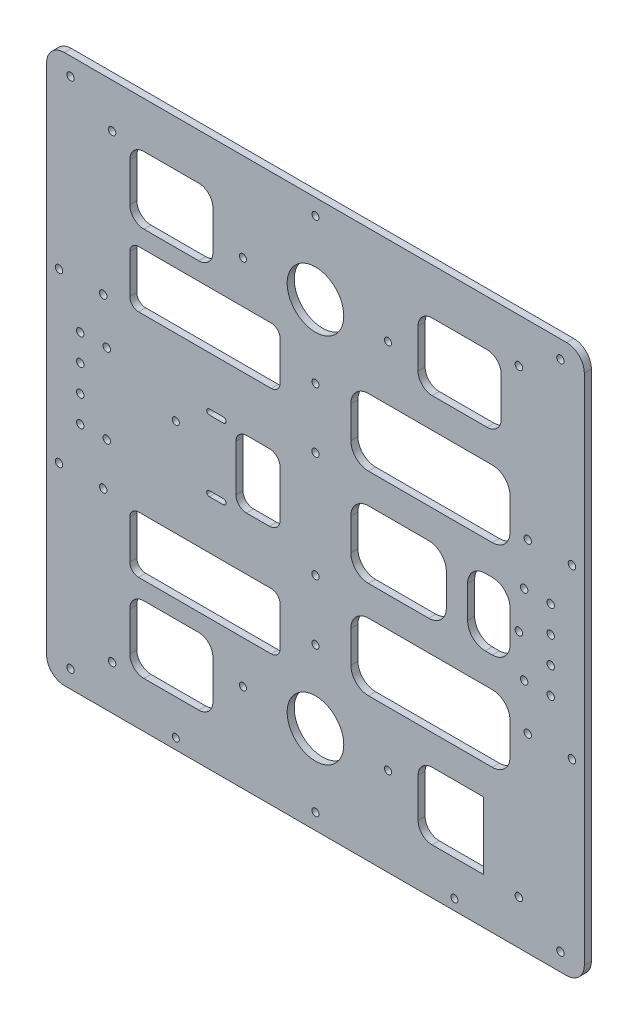
from build123d import *

# Parameters (mm, degrees)
SKETCH_1_R          = 2.1
SKETCH_1_R_2        = 2
SKETCH_1_R_3        = 16
EXTRUDE_1_DEPTH     = 4
CUT_EXTRUDE_1_REACH = 219.129
SKETCH_2_R          = 2.1
CUT_EXTRUDE_2_REACH = 219.129
SKETCH_3_R          = 2.1
CUT_EXTRUDE_3_REACH = 219.129
SKETCH_4_R          = 2.1
SKETCH_5_W          = 9.074439696
SKETCH_5_H          = 39.429402793
SKETCH_5_W_2        = 9.116595703
SKETCH_5_H_2        = 38.060432974
EXTRUDE_2_DEPTH     = 4
FILLET_1_R          = 8
SKETCH_6_W          = 8.766607102
SKETCH_6_H          = 39.413082466
SKETCH_6_W_2        = 8
EXTRUDE_3_DEPTH     = 4
FILLET_2_R          = 8
SKETCH_8_W          = 16.411626396
SKETCH_8_H          = 15.682220778
SKETCH_8_W_2        = 10.941084264
SKETCH_8_H_2        = 10.211678646
SKETCH_8_W_3        = 13.07641526
SKETCH_8_H_3        = 17.165917396
SKETCH_8_W_4        = 15.501833168
SKETCH_8_H_4        = 13.086487615
EXTRUDE_4_DEPTH     = 4
CUT_EXTRUDE_4_REACH = 219.129
SKETCH_7_R          = 2
SKETCH_9_R          = 2
CUT_EXTRUDE_5_DEPTH = 10
SKETCH_10_W         = 12
SKETCH_10_H         = 38
EXTRUDE_5_DEPTH     = 4
FILLET_3_R          = 10
SKETCH_12_W         = 10.901521511
SKETCH_12_H         = 38
EXTRUDE_6_DEPTH     = 4


with BuildPart() as part:
    # 草图1 → 凸台-拉伸1 (new body)
    with BuildSketch(Plane(origin=(0, 0, 0), x_dir=(-1, 0, 0), z_dir=(0, 0, -1))):
        with BuildLine():
            Line((142, 155), (-142, 155))
            ThreePointArc((-142, 155), (-149.071067812, 152.071067812), (-152, 145))
            Line((-152, 145), (-152, -145))
            ThreePointArc((-152, -145), (-149.071067812, -152.071067812), (-142, -155))
            Line((-142, -155), (142, -155))
            ThreePointArc((142, -155), (149.071067812, -152.071067812), (152, -145))
            Line((152, -145), (152, 145))
            ThreePointArc((152, 145), (149.071067812, 152.071067812), (142, 155))
        make_face()
        with Locations((0, 63.987806691)):
            Circle(SKETCH_1_R, mode=Mode.SUBTRACT)
        with Locations((0, 146.012193309)):
            Circle(SKETCH_1_R, mode=Mode.SUBTRACT)
        with Locations((0, -146.012193309)):
            Circle(SKETCH_1_R, mode=Mode.SUBTRACT)
        with Locations((41, 105)):
            Circle(SKETCH_1_R_2, mode=Mode.SUBTRACT)
        with Locations((0, -105)):
            Circle(SKETCH_1_R_3, mode=Mode.SUBTRACT)
        with Locations((0, 105)):
            Circle(SKETCH_1_R_3, mode=Mode.SUBTRACT)
        with Locations((0, -63.987806691)):
            Circle(SKETCH_1_R, mode=Mode.SUBTRACT)
        with Locations((-41, -105)):
            Circle(SKETCH_1_R_2, mode=Mode.SUBTRACT)
        with Locations((41, -105)):
            Circle(SKETCH_1_R_2, mode=Mode.SUBTRACT)
        with Locations((-41, 105)):
            Circle(SKETCH_1_R_2, mode=Mode.SUBTRACT)
        with Locations((120, 47.5)):
            Circle(SKETCH_1_R, mode=Mode.SUBTRACT)
        with Locations((-145, 47.5)):
            Circle(SKETCH_1_R, mode=Mode.SUBTRACT)
        with Locations((-145, -47.5)):
            Circle(SKETCH_1_R, mode=Mode.SUBTRACT)
        with Locations((-120, -47.5)):
            Circle(SKETCH_1_R, mode=Mode.SUBTRACT)
        with Locations((120, -47.5)):
            Circle(SKETCH_1_R, mode=Mode.SUBTRACT)
        with Locations((145, -47.5)):
            Circle(SKETCH_1_R, mode=Mode.SUBTRACT)
        with Locations((-115, 0)):
            Circle(SKETCH_1_R, mode=Mode.SUBTRACT)
        with Locations((145, 47.5)):
            Circle(SKETCH_1_R, mode=Mode.SUBTRACT)
        with Locations((0, -30)):
            Circle(SKETCH_1_R, mode=Mode.SUBTRACT)
        with Locations((0, 30)):
            Circle(SKETCH_1_R, mode=Mode.SUBTRACT)
        with Locations((115, 130)):
            Circle(SKETCH_1_R, mode=Mode.SUBTRACT)
        with Locations((115, -130)):
            Circle(SKETCH_1_R, mode=Mode.SUBTRACT)
        with Locations((-115, -130)):
            Circle(SKETCH_1_R, mode=Mode.SUBTRACT)
        with Locations((-115, 130)):
            Circle(SKETCH_1_R, mode=Mode.SUBTRACT)
        with Locations((-120, 47.5)):
            Circle(SKETCH_1_R, mode=Mode.SUBTRACT)
        with BuildLine():
            Line((60, -21.5), (52, -21.5))
            ThreePointArc((52, -21.5), (50.5, -20), (52, -18.5))
            Line((52, -18.5), (60, -18.5))
            ThreePointArc((60, -18.5), (61.5, -20), (60, -21.5))
        make_face(mode=Mode.SUBTRACT)
        with BuildLine():
            Line((60, 18.5), (52, 18.5))
            ThreePointArc((52, 18.5), (50.5, 20), (52, 21.5))
            Line((52, 21.5), (60, 21.5))
            ThreePointArc((60, 21.5), (61.5, 20), (60, 18.5))
        make_face(mode=Mode.SUBTRACT)
        with BuildLine():
            Line((-100, -36), (-30, -36))
            ThreePointArc((-30, -36), (-22.928932188, -38.928932188), (-20, -46))
            Line((-20, -46), (-20, -64))
            ThreePointArc((-20, -64), (-22.928932188, -71.071067812), (-30, -74))
            Line((-30, -74), (-100, -74))
            ThreePointArc((-100, -74), (-107.071067812, -71.071067812), (-110, -64))
            Line((-110, -64), (-110, -46))
            ThreePointArc((-110, -46), (-107.071067812, -38.928932188), (-100, -36))
        make_face(mode=Mode.SUBTRACT)
        with BuildLine():
            Line((-100, 19), (-30, 19))
            ThreePointArc((-30, 19), (-22.928932188, 16.071067812), (-20, 9))
            Line((-20, 9), (-20, -9))
            ThreePointArc((-20, -9), (-22.928932188, -16.071067812), (-30, -19))
            Line((-30, -19), (-100, -19))
            ThreePointArc((-100, -19), (-107.071067812, -16.071067812), (-110, -9))
            Line((-110, -9), (-110, 9))
            ThreePointArc((-110, 9), (-107.071067812, 16.071067812), (-100, 19))
        make_face(mode=Mode.SUBTRACT)
        with BuildLine():
            Line((-100, 74), (-30, 74))
            ThreePointArc((-30, 74), (-22.928932188, 71.071067812), (-20, 64))
            Line((-20, 64), (-20, 46))
            ThreePointArc((-20, 46), (-22.928932188, 38.928932188), (-30, 36))
            Line((-30, 36), (-100, 36))
            ThreePointArc((-100, 36), (-107.071067812, 38.928932188), (-110, 46))
            Line((-110, 46), (-110, 64))
            ThreePointArc((-110, 64), (-107.071067812, 71.071067812), (-100, 74))
        make_face(mode=Mode.SUBTRACT)
        with BuildLine():
            Line((25, 81), (100, 81))
            ThreePointArc((100, 81), (103.535533906, 79.535533906), (105, 76))
            Line((105, 76), (105, 54))
            ThreePointArc((105, 54), (103.535533906, 50.464466094), (100, 49))
            Line((100, 49), (25, 49))
            ThreePointArc((25, 49), (21.464466094, 50.464466094), (20, 54))
            Line((20, 54), (20, 76))
            ThreePointArc((20, 76), (21.464466094, 79.535533906), (25, 81))
        make_face(mode=Mode.SUBTRACT)
        with BuildLine():
            Line((25, -49), (100, -49))
            ThreePointArc((100, -49), (103.535533906, -50.464466094), (105, -54))
            Line((105, -54), (105, -76))
            ThreePointArc((105, -76), (103.535533906, -79.535533906), (100, -81))
            Line((100, -81), (25, -81))
            ThreePointArc((25, -81), (21.464466094, -79.535533906), (20, -76))
            Line((20, -76), (20, -54))
            ThreePointArc((20, -54), (21.464466094, -50.464466094), (25, -49))
        make_face(mode=Mode.SUBTRACT)
        with BuildLine():
            Line((-97, 129), (-58, 129))
            ThreePointArc((-58, 129), (-52.343145751, 126.656854249), (-50, 121))
            Line((-50, 121), (-50, 99))
            ThreePointArc((-50, 99), (-52.343145751, 93.343145751), (-58, 91))
            Line((-58, 91), (-97, 91))
            ThreePointArc((-97, 91), (-102.656854249, 93.343145751), (-105, 99))
            Line((-105, 99), (-105, 121))
            ThreePointArc((-105, 121), (-102.656854249, 126.656854249), (-97, 129))
        make_face(mode=Mode.SUBTRACT)
        with BuildLine():
            Line((97, 91), (58, 91))
            ThreePointArc((58, 91), (52.343145751, 93.343145751), (50, 99))
            Line((50, 99), (50, 121))
            ThreePointArc((50, 121), (52.343145751, 126.656854249), (58, 129))
            Line((58, 129), (97, 129))
            ThreePointArc((97, 129), (102.656854249, 126.656854249), (105, 121))
            Line((105, 121), (105, 99))
            ThreePointArc((105, 99), (102.656854249, 93.343145751), (97, 91))
        make_face(mode=Mode.SUBTRACT)
        with BuildLine():
            Line((39, -19), (26, -19))
            ThreePointArc((26, -19), (21.757359313, -17.242640687), (20, -13))
            Line((20, -13), (20, 13))
            ThreePointArc((20, 13), (21.757359313, 17.242640687), (26, 19))
            Line((26, 19), (39, 19))
            ThreePointArc((39, 19), (43.242640687, 17.242640687), (45, 13))
            Line((45, 13), (45, -13))
            ThreePointArc((45, -13), (43.242640687, -17.242640687), (39, -19))
        make_face(mode=Mode.SUBTRACT)
        with BuildLine():
            Line((97, -129), (58, -129))
            ThreePointArc((58, -129), (52.343145751, -126.656854249), (50, -121))
            Line((50, -121), (50, -99))
            ThreePointArc((50, -99), (52.343145751, -93.343145751), (58, -91))
            Line((58, -91), (97, -91))
            ThreePointArc((97, -91), (102.656854249, -93.343145751), (105, -99))
            Line((105, -99), (105, -121))
            ThreePointArc((105, -121), (102.656854249, -126.656854249), (97, -129))
        make_face(mode=Mode.SUBTRACT)
        with BuildLine():
            Line((-97, -91), (-58, -91))
            ThreePointArc((-58, -91), (-52.343145751, -93.343145751), (-50, -99))
            Line((-50, -99), (-50, -121))
            ThreePointArc((-50, -121), (-52.343145751, -126.656854249), (-58, -129))
            Line((-58, -129), (-97, -129))
            ThreePointArc((-97, -129), (-102.656854249, -126.656854249), (-105, -121))
            Line((-105, -121), (-105, -99))
            ThreePointArc((-105, -99), (-102.656854249, -93.343145751), (-97, -91))
        make_face(mode=Mode.SUBTRACT)
    extrude(amount=-EXTRUDE_1_DEPTH)

    # 草图2 → 切除-拉伸1 (cut, up to next)
    with BuildSketch(Plane(origin=(0, 0, 0), x_dir=(-1, 0, 0), z_dir=(0, 0, -1)), mode=Mode.PRIVATE) as cut_extrude_1_sk1:
        with Locations((-138.5, 145)):
            Circle(SKETCH_2_R)
    cut_extrude_1_tool1 = extrude(cut_extrude_1_sk1.sketch, amount=-CUT_EXTRUDE_1_REACH, mode=Mode.PRIVATE) & part.part
    # 草图2 → 切除-拉伸1 (cut, up to next)
    with BuildSketch(Plane(origin=(0, 0, 0), x_dir=(-1, 0, 0), z_dir=(0, 0, -1)), mode=Mode.PRIVATE) as cut_extrude_1_sk2:
        with Locations((138.5, 145)):
            Circle(SKETCH_2_R)
    cut_extrude_1_tool2 = extrude(cut_extrude_1_sk2.sketch, amount=-CUT_EXTRUDE_1_REACH, mode=Mode.PRIVATE) & part.part
    # 草图2 → 切除-拉伸1 (cut, up to next)
    with BuildSketch(Plane(origin=(0, 0, 0), x_dir=(-1, 0, 0), z_dir=(0, 0, -1)), mode=Mode.PRIVATE) as cut_extrude_1_sk3:
        with Locations((138.5, -145)):
            Circle(SKETCH_2_R)
    cut_extrude_1_tool3 = extrude(cut_extrude_1_sk3.sketch, amount=-CUT_EXTRUDE_1_REACH, mode=Mode.PRIVATE) & part.part
    # 草图2 → 切除-拉伸1 (cut, up to next)
    with BuildSketch(Plane(origin=(0, 0, 0), x_dir=(-1, 0, 0), z_dir=(0, 0, -1)), mode=Mode.PRIVATE) as cut_extrude_1_sk4:
        with Locations((-138.5, -145)):
            Circle(SKETCH_2_R)
    cut_extrude_1_tool4 = extrude(cut_extrude_1_sk4.sketch, amount=-CUT_EXTRUDE_1_REACH, mode=Mode.PRIVATE) & part.part
    add(cut_extrude_1_tool1.solids().sort_by_distance((138.5, 145, 0))[0], mode=Mode.SUBTRACT)
    add(cut_extrude_1_tool2.solids().sort_by_distance((-138.5, 145, 0))[0], mode=Mode.SUBTRACT)
    add(cut_extrude_1_tool3.solids().sort_by_distance((-138.5, -145, 0))[0], mode=Mode.SUBTRACT)
    add(cut_extrude_1_tool4.solids().sort_by_distance((138.5, -145, 0))[0], mode=Mode.SUBTRACT)

    # 草图3 → 切除-拉伸2 (cut, up to next)
    with BuildSketch(Plane(origin=(0, 0, 0), x_dir=(-1, 0, 0), z_dir=(0, 0, -1)), mode=Mode.PRIVATE) as cut_extrude_2_sk1:
        with Locations((133, 7.5)):
            Circle(SKETCH_3_R)
    cut_extrude_2_tool1 = extrude(cut_extrude_2_sk1.sketch, amount=-CUT_EXTRUDE_2_REACH, mode=Mode.PRIVATE) & part.part
    # 草图3 → 切除-拉伸2 (cut, up to next)
    with BuildSketch(Plane(origin=(0, 0, 0), x_dir=(-1, 0, 0), z_dir=(0, 0, -1)), mode=Mode.PRIVATE) as cut_extrude_2_sk2:
        with Locations((133, -7.5)):
            Circle(SKETCH_3_R)
    cut_extrude_2_tool2 = extrude(cut_extrude_2_sk2.sketch, amount=-CUT_EXTRUDE_2_REACH, mode=Mode.PRIVATE) & part.part
    # 草图3 → 切除-拉伸2 (cut, up to next)
    with BuildSketch(Plane(origin=(0, 0, 0), x_dir=(-1, 0, 0), z_dir=(0, 0, -1)), mode=Mode.PRIVATE) as cut_extrude_2_sk3:
        with Locations((133, -22.5)):
            Circle(SKETCH_3_R)
    cut_extrude_2_tool3 = extrude(cut_extrude_2_sk3.sketch, amount=-CUT_EXTRUDE_2_REACH, mode=Mode.PRIVATE) & part.part
    # 草图3 → 切除-拉伸2 (cut, up to next)
    with BuildSketch(Plane(origin=(0, 0, 0), x_dir=(-1, 0, 0), z_dir=(0, 0, -1)), mode=Mode.PRIVATE) as cut_extrude_2_sk4:
        with Locations((133, 22.5)):
            Circle(SKETCH_3_R)
    cut_extrude_2_tool4 = extrude(cut_extrude_2_sk4.sketch, amount=-CUT_EXTRUDE_2_REACH, mode=Mode.PRIVATE) & part.part
    cut_extrude_2_1 = cut_extrude_2_tool1.solids().sort_by_distance((-133, 7.5, 0))[0]
    add(cut_extrude_2_1, mode=Mode.SUBTRACT)
    cut_extrude_2_2 = cut_extrude_2_tool2.solids().sort_by_distance((-133, -7.5, 0))[0]
    add(cut_extrude_2_2, mode=Mode.SUBTRACT)
    cut_extrude_2_3 = cut_extrude_2_tool3.solids().sort_by_distance((-133, -22.5, 0))[0]
    add(cut_extrude_2_3, mode=Mode.SUBTRACT)
    cut_extrude_2_4 = cut_extrude_2_tool4.solids().sort_by_distance((-133, 22.5, 0))[0]
    add(cut_extrude_2_4, mode=Mode.SUBTRACT)
    cut_extrude_2 = cut_extrude_2_1 + cut_extrude_2_2 + cut_extrude_2_3 + cut_extrude_2_4  # 切除-拉伸2 as one shape, for the pattern or mirror that repeats it

    # 镜向1: 切除-拉伸2 across plane
    add(cut_extrude_2.mirror(Plane.ZY), mode=Mode.SUBTRACT)

    # 草图4 → 切除-拉伸3 (cut, up to next)
    with BuildSketch(Plane(origin=(0, 0, 0), x_dir=(-1, 0, 0), z_dir=(0, 0, -1)), mode=Mode.PRIVATE) as cut_extrude_3_sk1:
        with Locations((-118, 22.5)):
            Circle(SKETCH_4_R)
    cut_extrude_3_tool1 = extrude(cut_extrude_3_sk1.sketch, amount=-CUT_EXTRUDE_3_REACH, mode=Mode.PRIVATE) & part.part
    # 草图4 → 切除-拉伸3 (cut, up to next)
    with BuildSketch(Plane(origin=(0, 0, 0), x_dir=(-1, 0, 0), z_dir=(0, 0, -1)), mode=Mode.PRIVATE) as cut_extrude_3_sk2:
        with Locations((-118, -22.5)):
            Circle(SKETCH_4_R)
    cut_extrude_3_tool2 = extrude(cut_extrude_3_sk2.sketch, amount=-CUT_EXTRUDE_3_REACH, mode=Mode.PRIVATE) & part.part
    cut_extrude_3_1 = cut_extrude_3_tool1.solids().sort_by_distance((118, 22.5, 0))[0]
    add(cut_extrude_3_1, mode=Mode.SUBTRACT)
    cut_extrude_3_2 = cut_extrude_3_tool2.solids().sort_by_distance((118, -22.5, 0))[0]
    add(cut_extrude_3_2, mode=Mode.SUBTRACT)
    cut_extrude_3 = cut_extrude_3_1 + cut_extrude_3_2  # 切除-拉伸3 as one shape, for the pattern or mirror that repeats it

    # 镜向2: 切除-拉伸3 across plane
    add(cut_extrude_3.mirror(Plane.ZY), mode=Mode.SUBTRACT)

    # 草图5 → 凸台-拉伸2 (add)
    with BuildSketch(Plane(origin=(0, 0, 0), x_dir=(-1, 0, 0), z_dir=(0, 0, -1))):
        with Locations((-53.462780152, 109.285298603)):
            Rectangle(SKETCH_5_W, SKETCH_5_H)
        with Locations((53.441702149, 109.969783513)):
            Rectangle(SKETCH_5_W_2, SKETCH_5_H_2)
    extrude(amount=-EXTRUDE_2_DEPTH)

    # 圆角1
    fillet_1_edges = [part.edges().sort_by_distance(p)[0] for p in [
        (58, 91, 2),
        (58, 129, 2),
        (-58, 91, 2),
        (-58, 129, 2),
    ]]
    fillet(fillet_1_edges, radius=FILLET_1_R)

    # 草图6 → 凸台-拉伸3 (add)
    with BuildSketch(Plane(origin=(0, 0, 0), x_dir=(-1, 0, 0), z_dir=(0, 0, -1))):
        with Locations((-53.616696449, -110.706541233)):
            Rectangle(SKETCH_6_W, SKETCH_6_H)
        with Locations((54, -110.706541233)):
            Rectangle(SKETCH_6_W_2, SKETCH_6_H)
    extrude(amount=-EXTRUDE_3_DEPTH)

    # 圆角2
    fillet_2_edges = [part.edges().sort_by_distance(p)[0] for p in [
        (-58, -129, 2),
        (-58, -91, 2),
        (58, -129, 2),
        (58, -91, 2),
    ]]
    fillet(fillet_2_edges, radius=FILLET_2_R)

    # 草图8 → 凸台-拉伸4 (add)
    with BuildSketch(Plane(origin=(0, 0, 0), x_dir=(-1, 0, 0), z_dir=(0, 0, -1))):
        with Locations((1.805551979, 143.719584865)):
            Rectangle(SKETCH_8_W, SKETCH_8_H)
        with Locations((-0.929719087, 62.208507098)):
            Rectangle(SKETCH_8_W_2, SKETCH_8_H_2)
        with Locations((0.137946411, -64.971652375)):
            Rectangle(SKETCH_8_W_3, SKETCH_8_H_3)
        with Locations((-1.074762543, -145.291316458)):
            Rectangle(SKETCH_8_W_4, SKETCH_8_H_4)
    extrude(amount=-EXTRUDE_4_DEPTH)

    # 草图7 → 切除-拉伸4 (cut, up to next)
    with BuildSketch(Plane(origin=(0, 0, 0), x_dir=(-1, 0, 0), z_dir=(0, 0, -1)), mode=Mode.PRIVATE) as cut_extrude_4_sk1:
        with Locations((0, 146)):
            Circle(SKETCH_7_R)
    cut_extrude_4_tool1 = extrude(cut_extrude_4_sk1.sketch, amount=-CUT_EXTRUDE_4_REACH, mode=Mode.PRIVATE) & part.part
    # 草图7 → 切除-拉伸4 (cut, up to next)
    with BuildSketch(Plane(origin=(0, 0, 0), x_dir=(-1, 0, 0), z_dir=(0, 0, -1)), mode=Mode.PRIVATE) as cut_extrude_4_sk2:
        with Locations((0, 64)):
            Circle(SKETCH_7_R)
    cut_extrude_4_tool2 = extrude(cut_extrude_4_sk2.sketch, amount=-CUT_EXTRUDE_4_REACH, mode=Mode.PRIVATE) & part.part
    # 草图7 → 切除-拉伸4 (cut, up to next)
    with BuildSketch(Plane(origin=(0, 0, 0), x_dir=(-1, 0, 0), z_dir=(0, 0, -1)), mode=Mode.PRIVATE) as cut_extrude_4_sk3:
        with Locations((0, -64)):
            Circle(SKETCH_7_R)
    cut_extrude_4_tool3 = extrude(cut_extrude_4_sk3.sketch, amount=-CUT_EXTRUDE_4_REACH, mode=Mode.PRIVATE) & part.part
    # 草图7 → 切除-拉伸4 (cut, up to next)
    with BuildSketch(Plane(origin=(0, 0, 0), x_dir=(-1, 0, 0), z_dir=(0, 0, -1)), mode=Mode.PRIVATE) as cut_extrude_4_sk4:
        with Locations((0, -146)):
            Circle(SKETCH_7_R)
    cut_extrude_4_tool4 = extrude(cut_extrude_4_sk4.sketch, amount=-CUT_EXTRUDE_4_REACH, mode=Mode.PRIVATE) & part.part
    add(cut_extrude_4_tool1.solids().sort_by_distance((0, 146, 0))[0], mode=Mode.SUBTRACT)
    add(cut_extrude_4_tool2.solids().sort_by_distance((0, 64, 0))[0], mode=Mode.SUBTRACT)
    add(cut_extrude_4_tool3.solids().sort_by_distance((0, -64, 0))[0], mode=Mode.SUBTRACT)
    add(cut_extrude_4_tool4.solids().sort_by_distance((0, -146, 0))[0], mode=Mode.SUBTRACT)

    # 草图9 → 切除-拉伸5 (cut)
    with BuildSketch(Plane(origin=(0, 0, 0), x_dir=(-1, 0, 0), z_dir=(0, 0, -1))):
        with Locations((78.957231568, -149)):
            Circle(SKETCH_9_R)
        with Locations((78.957231568, 6)):
            Circle(SKETCH_9_R)
        with Locations((-78.542768432, -149)):
            Circle(SKETCH_9_R)
    extrude(amount=-CUT_EXTRUDE_5_DEPTH, mode=Mode.SUBTRACT)

    # 草图10 → 凸台-拉伸5 (add)
    with BuildSketch(Plane(origin=(0, 0, 0), x_dir=(-1, 0, 0), z_dir=(0, 0, -1))):
        with Locations((-80, 0)):
            Rectangle(SKETCH_10_W, SKETCH_10_H)
    extrude(amount=-EXTRUDE_5_DEPTH)

    # 圆角3
    fillet_3_edges = [part.edges().sort_by_distance(p)[0] for p in [
        (74, -19, 2),
        (74, 19, 2),
        (86, -19, 2),
        (86, 19, 2),
    ]]
    fillet(fillet_3_edges, radius=FILLET_3_R)

    # 草图12 → 凸台-拉伸6 (add)
    with BuildSketch(Plane(origin=(0, 0, 0), x_dir=(-1, 0, 0), z_dir=(0, 0, -1))):
        with Locations((-100.450760755, -110)):
            Rectangle(SKETCH_12_W, SKETCH_12_H)
    extrude(amount=-EXTRUDE_6_DEPTH)


solid = part.part
